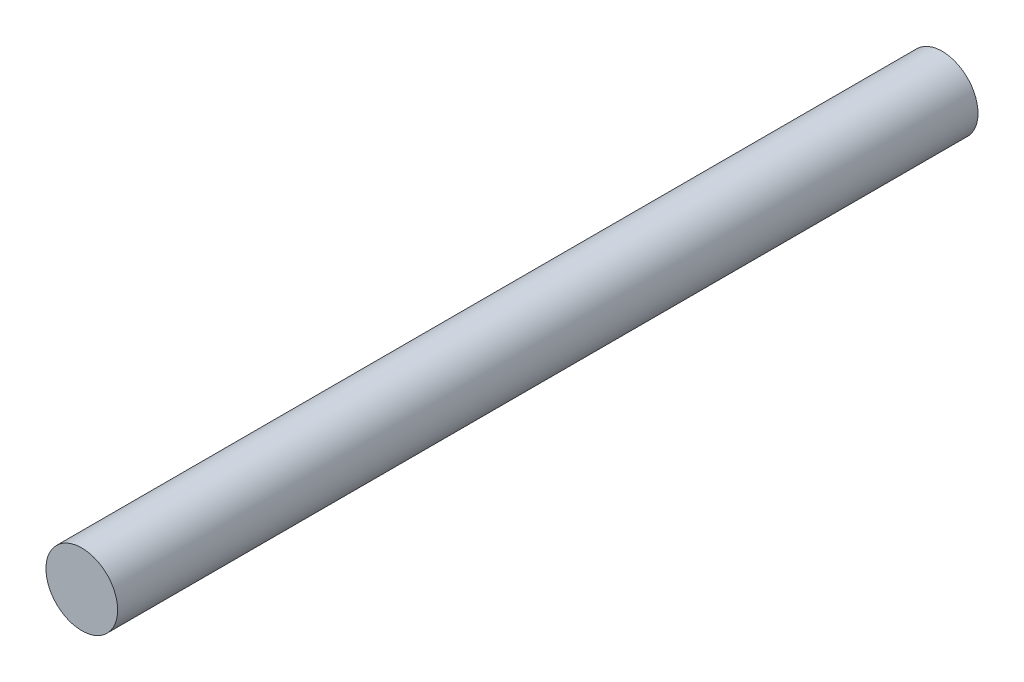
from build123d import *

# Parameters (mm, degrees)
SKETCH1_R           = 4.7625
BOSS_EXTRUDE1_DEPTH = 114.3


with BuildPart() as part:
    # Sketch1 → Boss-Extrude1 (new body)
    with BuildSketch(Plane.XY):
        Circle(SKETCH1_R)
    extrude(amount=BOSS_EXTRUDE1_DEPTH)


solid = part.part
